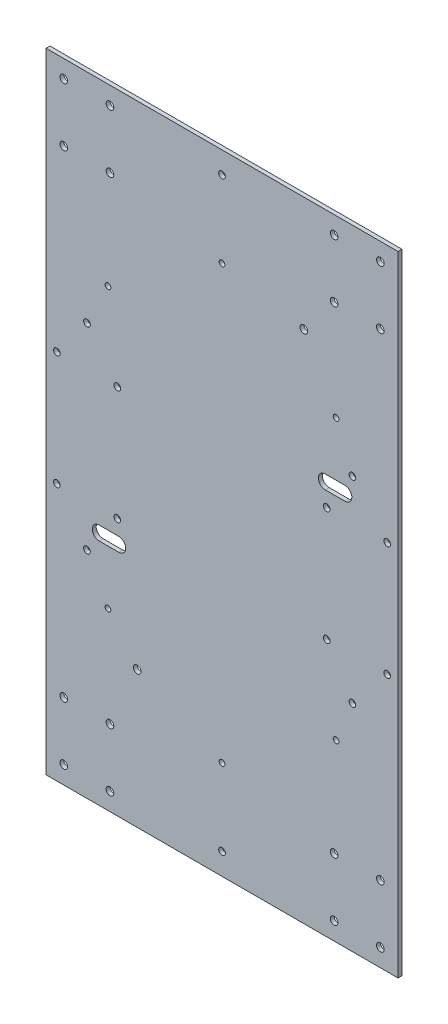
from build123d import *

# Parameters (mm, degrees)
CROQUIS1_W                     = 179
CROQUIS1_H                     = 320
SALIENTE_EXTRUIR1_DEPTH        = 2
TALADRO_DE_MARGEN_PARA_M31_D   = 3.4
TALADRO_DE_MARGEN_PARA_M2_51_D = 2.9
TALADRO_DE_MARGEN_PARA_M32_D   = 3.4
CORTAR_EXTRUIR1_DEPTH          = 184.34189374
TALADRO_DE_MARGEN_PARA_M3_51_D = 3.9
SIMETR_A4_COPY_1_D             = 3.9
SIMETR_A4_COPY_2_D             = 3.9
TALADRO_DE_MARGEN_PARA_M3_52_D = 3.9


with BuildPart() as part:
    # Croquis1 → Saliente-Extruir1 (new body)
    with BuildSketch(Plane.XY):
        Rectangle(CROQUIS1_W, CROQUIS1_H)
    extrude(amount=SALIENTE_EXTRUIR1_DEPTH)

    # Taladro de margen para M31 (through all)
    with Locations(Plane.XY.offset(2)):
        with Locations((0, 149), (-68.69, 49.42), (-68.69, -50.58), (0, -149), (66.31, -50.58), (66.31, 49.42)):
            Hole(TALADRO_DE_MARGEN_PARA_M31_D / 2)

    # Taladro de margen para M2.51 (through all)
    with Locations(Plane.XY.offset(2)):
        with Locations((0, 110), (-58, 71), (-58, -71), (0, -110), (58, -71), (58, 71)):
            Hole(TALADRO_DE_MARGEN_PARA_M2_51_D / 2)

    # Taladro de margen para M32 (through all)
    with Locations(Plane.XY.offset(2)):
        with Locations((-84, 29), (-84, -29), (-53.252582689, 29), (-53.252582689, -29), (53.252582689, 29), (84, 29), (84, -29), (53.252582689, -29)):
            Hole(TALADRO_DE_MARGEN_PARA_M32_D / 2)

    # Croquis10 → Cortar-Extruir1 (cut, through all)
    with BuildSketch(Plane.XY.offset(2)):
        with BuildLine():
            Line((-62.5, -36.5), (-52.5, -36.5))
            ThreePointArc((-52.5, -36.5), (-49, -40), (-52.5, -43.5))
            Line((-52.5, -43.5), (-62.5, -43.5))
            ThreePointArc((-62.5, -43.5), (-66, -40), (-62.5, -36.5))
        make_face()
        with BuildLine():
            Line((52.5, 43.5), (62.5, 43.5))
            ThreePointArc((62.5, 43.5), (66, 40), (62.5, 36.5))
            Line((62.5, 36.5), (52.5, 36.5))
            ThreePointArc((52.5, 36.5), (49, 40), (52.5, 43.5))
        make_face()
    extrude(amount=-CORTAR_EXTRUIR1_DEPTH, mode=Mode.SUBTRACT)

    # Taladro de margen para M3.51 (through all)
    with Locations(Plane.XY.offset(2)):
        with Locations((-80.5, -121.42), (-57, -121.42), (-57, -151), (-80.5, -151)):
            taladro_de_margen_para_m3_51 = Hole(TALADRO_DE_MARGEN_PARA_M3_51_D / 2)

    # Simetría3: Taladro de margen para M3.51 across plane
    add(taladro_de_margen_para_m3_51.mirror(Plane.ZX), mode=Mode.SUBTRACT)

    # Simetría4 copy 1 (through all)
    with Locations(Plane(origin=(0, 0, 2), x_dir=(-1, 0, 0), z_dir=(0, 0, 1))):
        with Locations((-80.5, -121.42), (-57, -121.42), (-57, -151), (-80.5, -151)):
            Hole(SIMETR_A4_COPY_1_D / 2)

    # Simetría4 copy 2 (through all)
    with Locations(Plane(origin=(0, 0, 2), x_dir=(-1, 0, 0), z_dir=(0, 0, 1))):
        with Locations((-80.5, 121.42), (-57, 121.42), (-57, 151), (-80.5, 151)):
            Hole(SIMETR_A4_COPY_2_D / 2)

    # Taladro de margen para M3.52 (through all)
    with Locations(Plane(origin=(0, 0, 0), x_dir=(-1, 0, 0), z_dir=(0, 0, -1))):
        with Locations((-41.6, 101.784994015), (43.2, -90.415005985)):
            Hole(TALADRO_DE_MARGEN_PARA_M3_52_D / 2)


solid = part.part
